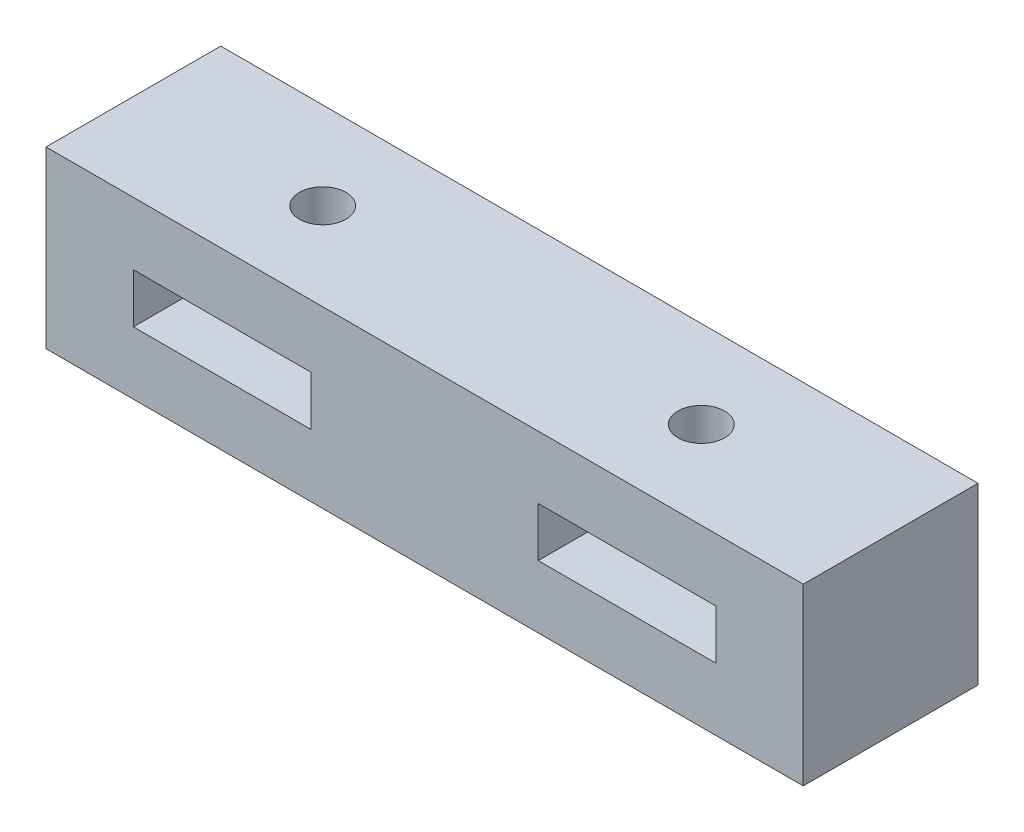
from build123d import *

# Parameters (mm, degrees)
CROQUIS1_W              = 52
CROQUIS1_H              = 12
CROQUIS1_W_2            = 12.2
CROQUIS1_H_2            = 3.4
SALIENTE_EXTRUIR1_DEPTH = 6
CROQUIS2_R              = 4.21875
CORTAR_EXTRUIR1_DEPTH   = 11
CROQUIS3_R              = 1.6
CORTAR_EXTRUIR2_DEPTH   = 30


with BuildPart() as part:
    # Croquis1 → Saliente-Extruir1 (new, symmetric)
    with BuildSketch(Plane.XY):
        Rectangle(CROQUIS1_W, CROQUIS1_H)
        with Locations((13.9, 0)):
            Rectangle(CROQUIS1_W_2, CROQUIS1_H_2, mode=Mode.SUBTRACT)
        with Locations((-13.9, 0)):
            Rectangle(CROQUIS1_W_2, CROQUIS1_H_2, mode=Mode.SUBTRACT)
    extrude(amount=SALIENTE_EXTRUIR1_DEPTH, both=True)

    # Croquis2 → Cortar-Extruir1 (cut)
    with BuildSketch(Plane(origin=(0, 0, -6), x_dir=(-1, 0, 0), z_dir=(0, 0, -1))):
        Circle(CROQUIS2_R)
    extrude(amount=-CORTAR_EXTRUIR1_DEPTH, mode=Mode.SUBTRACT)

    # Croquis3 → Cortar-Extruir2 (cut)
    with BuildSketch(Plane(origin=(0, 6, 0), x_dir=(1, 0, 0), z_dir=(0, 1, 0))):
        with Locations((-13, 0)):
            Circle(CROQUIS3_R)
        with Locations((13, 0)):
            Circle(CROQUIS3_R)
    extrude(amount=-CORTAR_EXTRUIR2_DEPTH, mode=Mode.SUBTRACT)


solid = part.part
